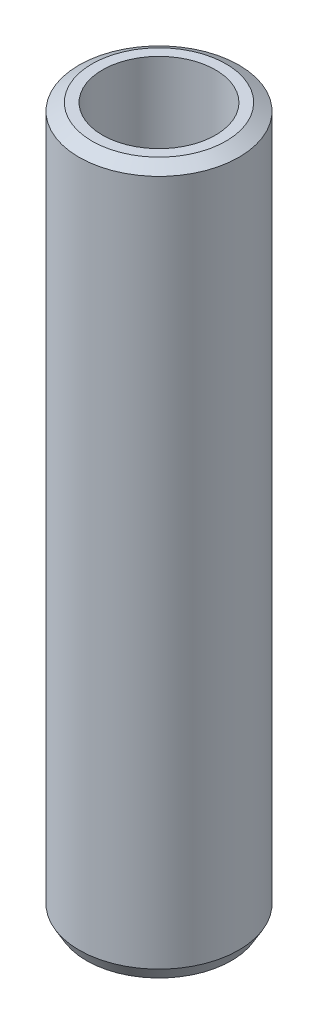
from build123d import *
from OCP.BRepFilletAPI import BRepFilletAPI_MakeChamfer

# Parameters (mm, degrees)
SKETCH1_R           = 52.5
BOSS_EXTRUDE1_DEPTH = 464.351984855
SKETCH2_R           = 37.145115567
CUT_EXTRUDE1_DEPTH  = 471.250216203
CHAMFER1_SIZE       = 4.916168382
CHAMFER1_SIZE2      = 8.515053416


with BuildPart() as part:
    # Sketch1 → Boss-Extrude1 (new body)
    with BuildSketch(Plane(origin=(0, 0, 0), x_dir=(1, 0, 0), z_dir=(0, 1, 0))):
        Circle(SKETCH1_R)
    extrude(amount=BOSS_EXTRUDE1_DEPTH)

    # Sketch2 → Cut-Extrude1 (cut, through all)
    with BuildSketch(Plane(origin=(0, 0, 0), x_dir=(1, 0, 0), z_dir=(0, 1, 0))):
        Circle(SKETCH2_R)
    extrude(amount=CUT_EXTRUDE1_DEPTH, mode=Mode.SUBTRACT)

    # Chamfer1: one chamfer whose edges measure the first distance from different faces: ONE call of the kernel's chamfer builder (chamfer() names one face for all edges)
    chamfer1_edges_1 = [part.edges().sort_by_distance(p)[0] for p in [
        (-52.5, 464.351984855, 0),
    ]]
    chamfer1_side_1 = [part.faces().sort_by_distance(p)[0] for p in [
        (-52.5, 232.175992428, 0),
    ]]
    chamfer1_edges_2 = [part.edges().sort_by_distance(p)[0] for p in [
        (-52.5, 0, 0),
    ]]
    chamfer1_side_2 = [part.faces().sort_by_distance(p)[0] for p in [
        (-51.01507576, 0, 0),
    ]]
    chamfer1 = BRepFilletAPI_MakeChamfer(part.part.solid().wrapped)
    for e in chamfer1_edges_1:
        chamfer1.Add(CHAMFER1_SIZE, CHAMFER1_SIZE2, e.wrapped, chamfer1_side_1[0].wrapped)  # the first distance lies on this face
    for e in chamfer1_edges_2:
        chamfer1.Add(CHAMFER1_SIZE, CHAMFER1_SIZE2, e.wrapped, chamfer1_side_2[0].wrapped)  # the first distance lies on this face
    add(Compound.cast(chamfer1.Shape()), mode=Mode.REPLACE)


solid = part.part
